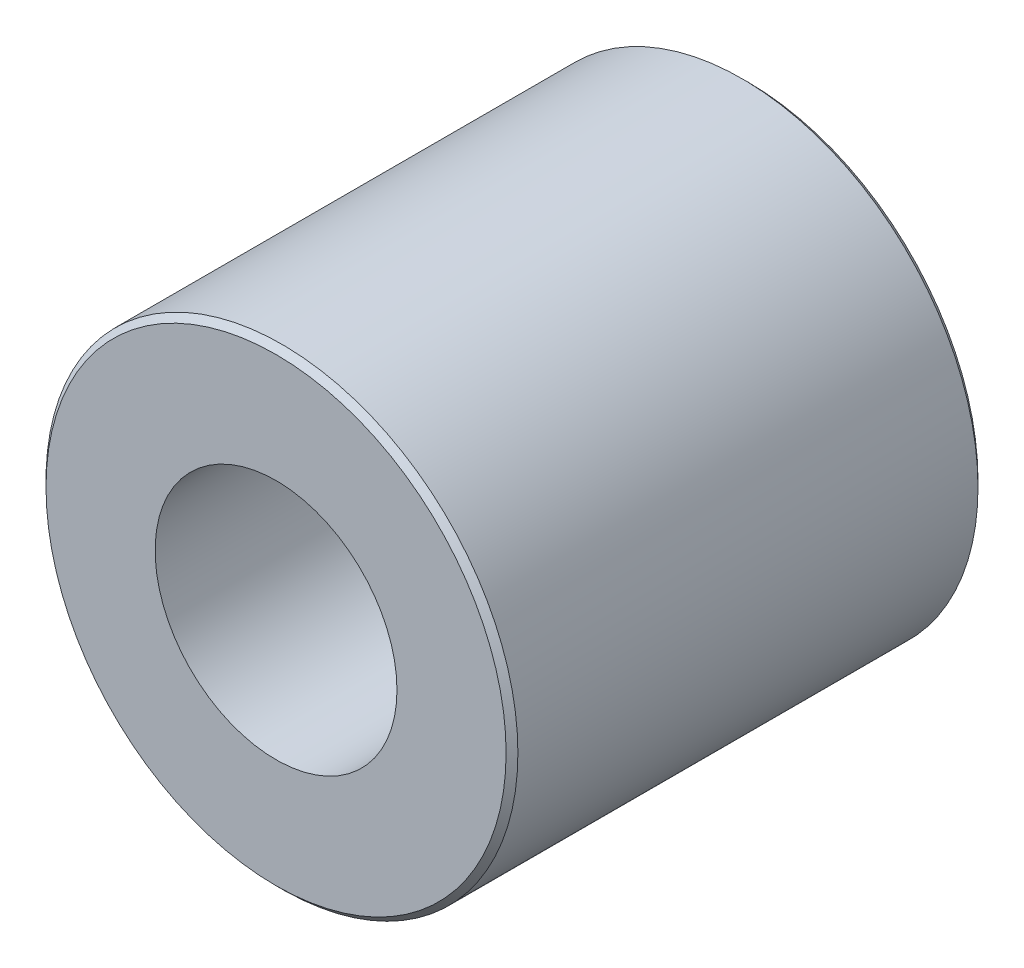
from build123d import *

# Parameters (mm, degrees)
ESQUISSE1_R              = 2
ESQUISSE1_R_2            = 1.06
EXTRUSION1_DEPTH         = 4
CHANFREIN1_SIZE          = 0.05
SUPPRIMERFACE1_OUTLINE_R = 1.06
SUPPRIMERFACE1_DEPTH     = 4
TROU_TARAUD_M2_51_D      = 2.05


# Read off the part's stored shape, not the designer's step: SupprimerFace1
with BuildPart() as part:
    # Esquisse1 → Extrusion1 (new body)
    with BuildSketch(Plane.XY):
        Circle(ESQUISSE1_R)
        Circle(ESQUISSE1_R_2, mode=Mode.SUBTRACT)
    extrude(amount=EXTRUSION1_DEPTH)

    # Chanfrein1
    chanfrein1_edges = [part.edges().sort_by_distance(p)[0] for p in [
        (-2, 0, 0),
        (-2, 0, 4),
    ]]
    chamfer(chanfrein1_edges, length=CHANFREIN1_SIZE)

    # SupprimerFace1 outline → SupprimerFace1 (add)
    with BuildSketch(Plane.XY):
        Circle(SUPPRIMERFACE1_OUTLINE_R)
    extrude(amount=SUPPRIMERFACE1_DEPTH)

    # Trou taraudé M2.51 (through all)
    with Locations(Plane.XY.offset(4)):
        with Locations((0, 0)):
            Hole(TROU_TARAUD_M2_51_D / 2)


solid = part.part
